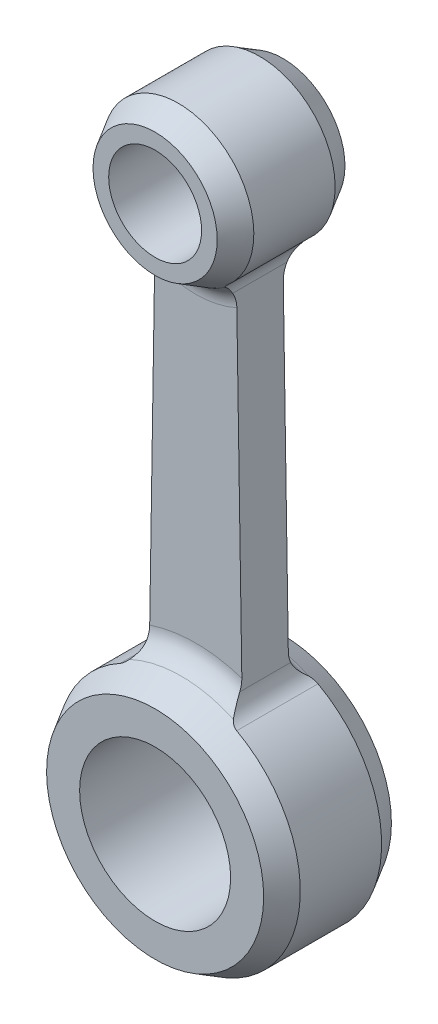
from build123d import *

# Parameters (mm, degrees)
ESQUISSE1_R          = 6.5
ESQUISSE1_R_2        = 4
BASE_EXTRUSION_DEPTH = 4
ESQUISSE2_R          = 6.5
ESQUISSE2_R_2        = 4
ESQUISSE2_R_3        = 10.5
BOSS_EXTRU_1_DEPTH   = 3.5
BOSS_EXTRU_2_START   = 3.5
ESQUISSE3_R          = 6.5
ESQUISSE3_R_2        = 4
ESQUISSE3_R_3        = 10.5
BOSS_EXTRU_2_DEPTH   = 3.5
CONG_1_R             = 2


with BuildPart() as part:
    # Esquisse1 → Base-Extrusion (new body)
    with BuildSketch(Plane.XY):
        with BuildLine():
            Line((-3.5, 41.522774425), (-4, 9.708243919))
            ThreePointArc((-4, 9.708243919), (0, -10.5), (4, 9.708243919))
            Line((4, 9.708243919), (3.5, 41.522774425))
            ThreePointArc((3.5, 41.522774425), (0, 53.5), (-3.5, 41.522774425))
        make_face()
        Circle(ESQUISSE1_R, mode=Mode.SUBTRACT)
        with Locations((0, 47)):
            Circle(ESQUISSE1_R_2, mode=Mode.SUBTRACT)
    extrude(amount=BASE_EXTRUSION_DEPTH)

    # Esquisse2 → Boss.-Extru.1 (add)
    # profile 1 of 2: a face of its own
    with BuildSketch(Plane.XY.offset(4)):
        with Locations(Location((0, 47, 0), (0, 0, 237.421029607))):
            Circle(ESQUISSE2_R)
        with Locations((0, 47)):
            Circle(ESQUISSE2_R_2, mode=Mode.SUBTRACT)
    # profile 2 of 2: a face of its own
    with BuildSketch(Plane.XY.offset(4)):
        with Locations(Location((0, 0, 0), (0, 0, 112.392687805))):
            Circle(ESQUISSE2_R_3)
        Circle(ESQUISSE2_R, mode=Mode.SUBTRACT)
    extrude(amount=BOSS_EXTRU_1_DEPTH)

    # Esquisse3 → Boss.-Extru.2 (add)
    # profile 1 of 2: a face of its own
    with BuildSketch(Plane(origin=(0, 0, 0), x_dir=(-1, 0, 0), z_dir=(0, 0, -1)).offset(BOSS_EXTRU_2_START)):
        with Locations((0, 47)):
            Circle(ESQUISSE3_R)
        with Locations((0, 47)):
            Circle(ESQUISSE3_R_2, mode=Mode.SUBTRACT)
    # profile 2 of 2: a face of its own
    with BuildSketch(Plane(origin=(0, 0, 0), x_dir=(-1, 0, 0), z_dir=(0, 0, -1)).offset(BOSS_EXTRU_2_START)):
        Circle(ESQUISSE3_R_3)
        Circle(ESQUISSE3_R, mode=Mode.SUBTRACT)
    extrude(amount=-BOSS_EXTRU_2_DEPTH)

    # Congé1
    # the kernel refuses this fillet: 2 mm, written as the material it adds along each edge
    with BuildSketch(Plane(origin=(0, 47, 4), x_dir=(-0.9730257841086011, -0.23069638805113993, 0), z_dir=(-0.23069638805113993, 0.9730257841086011, 0))) as cong_1_piece_1_section:
        with BuildLine():
            CenterArc((6.5 + CONG_1_R, CONG_1_R), CONG_1_R, 180, 90)
            Line((6.5 + CONG_1_R, 0), (6.5, 0))
            Line((6.5, 0), (6.5, CONG_1_R))
        make_face()
    cong_1_piece_1 = revolve(axis=Axis((0, 47, 4), (0, 0, 1)), revolution_arc=153.323851042, mode=Mode.PRIVATE)
    cong_1_piece_1 = split(cong_1_piece_1, bisect_by=Plane(origin=(3.517247673, 40.425321182, 4.453760359), z_dir=(-0.9998765251425995, -0.015714148680750627, 0)), keep=Keep.TOP, mode=Mode.PRIVATE)
    cong_1_piece_1 = split(cong_1_piece_1, bisect_by=Plane(origin=(-3.517247673, 40.425321169, 4.453760359), z_dir=(0.9998765251425995, -0.0157141486807504, 0)), keep=Keep.TOP, mode=Mode.PRIVATE)
    add(cong_1_piece_1)
    with BuildSketch(Plane(origin=(0, 0, 4), x_dir=(0.7624324114570696, 0.6470678619432104, 0), z_dir=(0.6470678619432104, -0.7624324114570696, 0))) as cong_1_piece_2_section:
        with BuildLine():
            CenterArc((10.5 + CONG_1_R, CONG_1_R), CONG_1_R, 180, 90)
            Line((10.5, CONG_1_R), (10.5, 0))
            Line((10.5, 0), (10.5 + CONG_1_R, 0))
        make_face()
    cong_1_piece_2 = revolve(axis=Axis((0, 0, 4), (0, 0, 1)), revolution_arc=99.358211417, mode=Mode.PRIVATE)
    cong_1_piece_2 = split(cong_1_piece_2, bisect_by=Plane(origin=(3.983456329, 10.760902188, 4.453755319), z_dir=(-0.9998765251425995, -0.015714148680750627, 0)), keep=Keep.TOP, mode=Mode.PRIVATE)
    cong_1_piece_2 = split(cong_1_piece_2, bisect_by=Plane(origin=(-3.983456328, 10.760902231, 4.453755319), z_dir=(0.9998765251425995, -0.0157141486807504, 0)), keep=Keep.TOP, mode=Mode.PRIVATE)
    add(cong_1_piece_2)
    with BuildSketch(Plane(origin=(0, 47, 0), x_dir=(0.9730257841078124, -0.23069638805446635, 0), z_dir=(0.23069638805446635, 0.9730257841078124, 0))) as cong_1_piece_3_section:
        with BuildLine():
            CenterArc((6.5 + CONG_1_R, CONG_1_R), CONG_1_R, 180, 90)
            Line((6.5, CONG_1_R), (6.5, 0))
            Line((6.5, 0), (6.5 + CONG_1_R, 0))
        make_face()
    cong_1_piece_3 = revolve(axis=Axis((0, 47, 0), (0, 0, -1)), revolution_arc=153.323851042, mode=Mode.PRIVATE)
    cong_1_piece_3 = split(cong_1_piece_3, bisect_by=Plane(origin=(3.517247674, 40.425321152, -0.453760356), z_dir=(-0.9998765251425995, -0.015714148680750627, 0)), keep=Keep.TOP, mode=Mode.PRIVATE)
    cong_1_piece_3 = split(cong_1_piece_3, bisect_by=Plane(origin=(-3.517247674, 40.425321145, -0.453760356), z_dir=(0.9998765251425995, -0.0157141486807504, 0)), keep=Keep.TOP, mode=Mode.PRIVATE)
    add(cong_1_piece_3)
    with BuildSketch(Plane(origin=(0, 0, 0), x_dir=(-0.7624324114570697, 0.6470678619432102, 0), z_dir=(-0.6470678619432102, -0.7624324114570697, 0))) as cong_1_piece_4_section:
        with BuildLine():
            CenterArc((10.5 + CONG_1_R, CONG_1_R), CONG_1_R, 180, 90)
            Line((10.5, CONG_1_R), (10.5, 0))
            Line((10.5, 0), (10.5 + CONG_1_R, 0))
        make_face()
    cong_1_piece_4 = revolve(axis=Axis((0, 0, 0), (0, 0, -1)), revolution_arc=99.358211417, mode=Mode.PRIVATE)
    cong_1_piece_4 = split(cong_1_piece_4, bisect_by=Plane(origin=(3.983456329, 10.760902188, -0.453755319), z_dir=(-0.9998765251425995, -0.015714148680750627, 0)), keep=Keep.TOP, mode=Mode.PRIVATE)
    cong_1_piece_4 = split(cong_1_piece_4, bisect_by=Plane(origin=(-3.983456328, 10.760902231, -0.453755319), z_dir=(0.9998765251425995, -0.0157141486807504, 0)), keep=Keep.TOP, mode=Mode.PRIVATE)
    add(cong_1_piece_4)
    with BuildSketch(Plane(origin=(3.5, 41.522774425, 0), x_dir=(0.015714148680751626, -0.9998765251425993, 0), z_dir=(0, 0, 1))) as cong_1_piece_5:
        with BuildLine():
            CenterArc((1.021621466, 2), CONG_1_R, 219.559716944, 50.440283056)
            ThreePointArc((-0.520300949, 0.726235788), (-0.247658669, 0.372067464), (0, 0))
            Line((0, 0), (1.021621466, 0))
        make_face()
    extrude(amount=4)
    with BuildSketch(Plane(origin=(4, 9.708243919, 0), x_dir=(-0.01571414868075148, 0.9998765251425994, 0), z_dir=(0, 0, 1))) as cong_1_piece_6:
        with BuildLine():
            CenterArc((1.237085323, -2), CONG_1_R, 90, 60.517017612)
            ThreePointArc((-0.503918505, -1.015669938), (-0.238240031, -0.514641677), (0, 0))
            Line((0, 0), (1.237085323, 0))
        make_face()
    extrude(amount=4)
    with BuildSketch(Plane(origin=(-4, 9.708243919, 0), x_dir=(-0.902678139107061, -0.4303163687082024, 0), z_dir=(0, 0, 1))) as cong_1_piece_7:
        with BuildLine():
            CenterArc((1.241789087, -1.997082863), CONG_1_R, 93.094951563, 60.517017612)
            Line((-0.549820165, -1.108186755), (0, 0))
            ThreePointArc((0, 0), (0.566903714, -0.01531497), (1.133807427, 0))
        make_face()
    extrude(amount=4)
    with BuildSketch(Plane(origin=(-3.5, 41.522774425, 0), x_dir=(-0.8036539633603179, 0.5950968888973062, 0), z_dir=(0, 0, 1))) as cong_1_piece_8:
        with BuildLine():
            CenterArc((1.030825449, 1.995271739), CONG_1_R, 215.61914794, 50.440283056)
            Line((-0.594986898, 0.830482396), (0, 0))
            ThreePointArc((0, 0), (0.446691028, 0.015366847), (0.893382055, 0))
        make_face()
    extrude(amount=4)
    with BuildSketch(Plane(origin=(-3.5, 41.522774425, 0), x_dir=(-0.8036539633603179, 0.5950968888973062, 0), z_dir=(0, 0, 1))) as cong_1_piece_9a_section:
        with BuildLine():
            CenterArc((1.030825449, 1.995271739), CONG_1_R, 215.61914794, 50.440283056)
            Line((-0.594986898, 0.830482396), (0, 0))
            ThreePointArc((0, 0), (0.446691028, 0.015366847), (0.893382055, 0))
        make_face()
    cong_1_piece_9a = extrude(amount=6.554053664, mode=Mode.PRIVATE)
    cong_1_piece_9a = split(cong_1_piece_9a, bisect_by=Plane(origin=(-3.656694751, 41.398372056, 4), z_dir=(0, 0, 1)), keep=Keep.TOP, mode=Mode.PRIVATE)
    with BuildSketch(Plane(origin=(0, 47, 4), x_dir=(-0.9730257841086011, -0.23069638805113993, 0), z_dir=(-0.23069638805113993, 0.9730257841086011, 0))) as cong_1_piece_9b_section:
        with BuildLine():
            CenterArc((6.5 + CONG_1_R, CONG_1_R), CONG_1_R, 180, 90)
            Line((6.5 + CONG_1_R, 0), (6.5, 0))
            Line((6.5, 0), (6.5, CONG_1_R))
        make_face()
    cong_1_piece_9b = revolve(axis=Axis((0, 47, 4), (0, 0, 1)), revolution_arc=153.323851042, mode=Mode.PRIVATE)
    cong_1_piece_9b = split(cong_1_piece_9b, bisect_by=Plane(origin=(-3.4781959, 42.910148851, 4.426023239), z_dir=(-0.9998765251425995, 0.0157141486807504, 0)), keep=Keep.TOP, mode=Mode.PRIVATE)
    cong_1_piece_9 = cong_1_piece_9a & cong_1_piece_9b
    add(cong_1_piece_9)
    with BuildSketch(Plane(origin=(3.5, 41.522774425, 0), x_dir=(0.015714148680751626, -0.9998765251425993, 0), z_dir=(0, 0, 1))) as cong_1_piece_10a_section:
        with BuildLine():
            CenterArc((1.021621466, 2), CONG_1_R, 219.559716944, 50.440283056)
            ThreePointArc((-0.520300949, 0.726235788), (-0.247658669, 0.372067464), (0, 0))
            Line((0, 0), (1.021621466, 0))
        make_face()
    cong_1_piece_10a = extrude(amount=6.554053664, mode=Mode.PRIVATE)
    cong_1_piece_10a = split(cong_1_piece_10a, bisect_by=Plane(origin=(3.656694751, 41.398372056, 4), z_dir=(0, 0, 1)), keep=Keep.TOP, mode=Mode.PRIVATE)
    with BuildSketch(Plane(origin=(0, 47, 4), x_dir=(-0.9730257841086011, -0.23069638805113993, 0), z_dir=(-0.23069638805113993, 0.9730257841086011, 0))) as cong_1_piece_10b_section:
        with BuildLine():
            CenterArc((6.5 + CONG_1_R, CONG_1_R), CONG_1_R, 180, 90)
            Line((6.5 + CONG_1_R, 0), (6.5, 0))
            Line((6.5, 0), (6.5, CONG_1_R))
        make_face()
    cong_1_piece_10b = revolve(axis=Axis((0, 47, 4), (0, 0, 1)), revolution_arc=153.323851042, mode=Mode.PRIVATE)
    cong_1_piece_10b = split(cong_1_piece_10b, bisect_by=Plane(origin=(3.478195889, 42.91014955, 4.426023438), z_dir=(0.9998765251425995, 0.015714148680750627, 0)), keep=Keep.TOP, mode=Mode.PRIVATE)
    cong_1_piece_10 = cong_1_piece_10a & cong_1_piece_10b
    add(cong_1_piece_10)
    with BuildSketch(Plane(origin=(4, 9.708243919, 0), x_dir=(-0.01571414868075148, 0.9998765251425994, 0), z_dir=(0, 0, 1))) as cong_1_piece_11a_section:
        with BuildLine():
            CenterArc((1.237085323, -2), CONG_1_R, 90, 60.517017612)
            ThreePointArc((-0.503918505, -1.015669938), (-0.238240031, -0.514641677), (0, 0))
            Line((0, 0), (1.237085323, 0))
        make_face()
    cong_1_piece_11a = extrude(amount=7.092713308, mode=Mode.PRIVATE)
    cong_1_piece_11a = split(cong_1_piece_11a, bisect_by=Plane(origin=(4.217733498, 9.886431085, 4), z_dir=(0, 0, 1)), keep=Keep.TOP, mode=Mode.PRIVATE)
    with BuildSketch(Plane(origin=(0, 0, 4), x_dir=(0.7624324114570696, 0.6470678619432104, 0), z_dir=(0.6470678619432104, -0.7624324114570696, 0))) as cong_1_piece_11b_section:
        with BuildLine():
            CenterArc((10.5 + CONG_1_R, CONG_1_R), CONG_1_R, 180, 90)
            Line((10.5, CONG_1_R), (10.5, 0))
            Line((10.5, 0), (10.5 + CONG_1_R, 0))
        make_face()
    cong_1_piece_11b = revolve(axis=Axis((0, 0, 4), (0, 0, 1)), revolution_arc=99.358211417, mode=Mode.PRIVATE)
    cong_1_piece_11b = split(cong_1_piece_11b, bisect_by=Plane(origin=(4.014039925, 8.814896672, 4.434458184), z_dir=(0.9998765251425995, 0.015714148680750627, 0)), keep=Keep.TOP, mode=Mode.PRIVATE)
    cong_1_piece_11 = cong_1_piece_11a & cong_1_piece_11b
    add(cong_1_piece_11)
    with BuildSketch(Plane(origin=(-4, 9.708243919, 0), x_dir=(-0.902678139107061, -0.4303163687082024, 0), z_dir=(0, 0, 1))) as cong_1_piece_12a_section:
        with BuildLine():
            CenterArc((1.241789087, -1.997082863), CONG_1_R, 93.094951563, 60.517017612)
            Line((-0.549820165, -1.108186755), (0, 0))
            ThreePointArc((0, 0), (0.566903714, -0.01531497), (1.133807427, 0))
        make_face()
    cong_1_piece_12a = extrude(amount=7.092713308, mode=Mode.PRIVATE)
    cong_1_piece_12a = split(cong_1_piece_12a, bisect_by=Plane(origin=(-4.217733498, 9.886431085, 4), z_dir=(0, 0, 1)), keep=Keep.TOP, mode=Mode.PRIVATE)
    with BuildSketch(Plane(origin=(0, 0, 4), x_dir=(0.7624324114570696, 0.6470678619432104, 0), z_dir=(0.6470678619432104, -0.7624324114570696, 0))) as cong_1_piece_12b_section:
        with BuildLine():
            CenterArc((10.5 + CONG_1_R, CONG_1_R), CONG_1_R, 180, 90)
            Line((10.5, CONG_1_R), (10.5, 0))
            Line((10.5, 0), (10.5 + CONG_1_R, 0))
        make_face()
    cong_1_piece_12b = revolve(axis=Axis((0, 0, 4), (0, 0, 1)), revolution_arc=99.358211417, mode=Mode.PRIVATE)
    cong_1_piece_12b = split(cong_1_piece_12b, bisect_by=Plane(origin=(-4.014039941, 8.814895643, 4.434458219), z_dir=(-0.9998765251425995, 0.0157141486807504, 0)), keep=Keep.TOP, mode=Mode.PRIVATE)
    cong_1_piece_12 = cong_1_piece_12a & cong_1_piece_12b
    add(cong_1_piece_12)
    with BuildSketch(Plane(origin=(3.5, 41.522774425, -2.554053664), x_dir=(0.01571414868075119, -0.9998765251425993, 0), z_dir=(0, 0, 1))) as cong_1_piece_13a_section:
        with BuildLine():
            CenterArc((1.021621466, 2), CONG_1_R, 219.559716944, 50.440283056)
            ThreePointArc((-0.520300949, 0.726235788), (-0.247658669, 0.372067464), (0, 0))
            Line((0, 0), (1.021621466, 0))
        make_face()
    cong_1_piece_13a = extrude(amount=6.554053664, mode=Mode.PRIVATE)
    cong_1_piece_13a = split(cong_1_piece_13a, bisect_by=Plane(origin=(3.656694751, 41.398372056, 0), z_dir=(0, 0, -1)), keep=Keep.TOP, mode=Mode.PRIVATE)
    with BuildSketch(Plane(origin=(0, 47, 0), x_dir=(0.9730257841078124, -0.23069638805446635, 0), z_dir=(0.23069638805446635, 0.9730257841078124, 0))) as cong_1_piece_13b_section:
        with BuildLine():
            CenterArc((6.5 + CONG_1_R, CONG_1_R), CONG_1_R, 180, 90)
            Line((6.5, CONG_1_R), (6.5, 0))
            Line((6.5, 0), (6.5 + CONG_1_R, 0))
        make_face()
    cong_1_piece_13b = revolve(axis=Axis((0, 47, 0), (0, 0, -1)), revolution_arc=153.323851042, mode=Mode.PRIVATE)
    cong_1_piece_13b = split(cong_1_piece_13b, bisect_by=Plane(origin=(3.478195898, 42.910148966, -0.426023306), z_dir=(0.9998765251425995, 0.015714148680750627, 0)), keep=Keep.TOP, mode=Mode.PRIVATE)
    cong_1_piece_13 = cong_1_piece_13a & cong_1_piece_13b
    add(cong_1_piece_13)
    with BuildSketch(Plane(origin=(-3.5, 41.522774425, -2.554053664), x_dir=(-0.8036539633603179, 0.5950968888973062, 0), z_dir=(0, 0, 1))) as cong_1_piece_14a_section:
        with BuildLine():
            CenterArc((1.030825449, 1.995271739), CONG_1_R, 215.61914794, 50.440283056)
            Line((-0.594986898, 0.830482396), (0, 0))
            ThreePointArc((0, 0), (0.446691028, 0.015366847), (0.893382055, 0))
        make_face()
    cong_1_piece_14a = extrude(amount=6.554053664, mode=Mode.PRIVATE)
    cong_1_piece_14a = split(cong_1_piece_14a, bisect_by=Plane(origin=(-3.656694751, 41.398372056, 0), z_dir=(0, 0, -1)), keep=Keep.TOP, mode=Mode.PRIVATE)
    with BuildSketch(Plane(origin=(0, 47, 0), x_dir=(0.9730257841078124, -0.23069638805446635, 0), z_dir=(0.23069638805446635, 0.9730257841078124, 0))) as cong_1_piece_14b_section:
        with BuildLine():
            CenterArc((6.5 + CONG_1_R, CONG_1_R), CONG_1_R, 180, 90)
            Line((6.5, CONG_1_R), (6.5, 0))
            Line((6.5, 0), (6.5 + CONG_1_R, 0))
        make_face()
    cong_1_piece_14b = revolve(axis=Axis((0, 47, 0), (0, 0, -1)), revolution_arc=153.323851042, mode=Mode.PRIVATE)
    cong_1_piece_14b = split(cong_1_piece_14b, bisect_by=Plane(origin=(-3.478195892, 42.910149335, -0.42602338), z_dir=(-0.9998765251425995, 0.0157141486807504, 0)), keep=Keep.TOP, mode=Mode.PRIVATE)
    cong_1_piece_14 = cong_1_piece_14a & cong_1_piece_14b
    add(cong_1_piece_14)
    with BuildSketch(Plane(origin=(-4, 9.708243919, -3.092713308), x_dir=(-0.9026781391070603, -0.43031636870820344, 0), z_dir=(0, 0, 1))) as cong_1_piece_15a_section:
        with BuildLine():
            CenterArc((1.241789087, -1.997082863), CONG_1_R, 93.094951563, 60.517017612)
            Line((-0.549820165, -1.108186755), (0, 0))
            ThreePointArc((0, 0), (0.566903714, -0.01531497), (1.133807427, 0))
        make_face()
    cong_1_piece_15a = extrude(amount=7.092713308, mode=Mode.PRIVATE)
    cong_1_piece_15a = split(cong_1_piece_15a, bisect_by=Plane(origin=(-4.217733498, 9.886431085, 0), z_dir=(0, 0, -1)), keep=Keep.TOP, mode=Mode.PRIVATE)
    with BuildSketch(Plane(origin=(0, 0, 0), x_dir=(-0.7624324114570697, 0.6470678619432102, 0), z_dir=(-0.6470678619432102, -0.7624324114570697, 0))) as cong_1_piece_15b_section:
        with BuildLine():
            CenterArc((10.5 + CONG_1_R, CONG_1_R), CONG_1_R, 180, 90)
            Line((10.5, CONG_1_R), (10.5, 0))
            Line((10.5, 0), (10.5 + CONG_1_R, 0))
        make_face()
    cong_1_piece_15b = revolve(axis=Axis((0, 0, 0), (0, 0, -1)), revolution_arc=99.358211417, mode=Mode.PRIVATE)
    cong_1_piece_15b = split(cong_1_piece_15b, bisect_by=Plane(origin=(-4.014039934, 8.814896084, -0.434458135), z_dir=(-0.9998765251425995, 0.0157141486807504, 0)), keep=Keep.TOP, mode=Mode.PRIVATE)
    cong_1_piece_15 = cong_1_piece_15a & cong_1_piece_15b
    add(cong_1_piece_15)
    with BuildSketch(Plane(origin=(4, 9.708243919, -3.092713308), x_dir=(-0.015714148680750762, 0.9998765251425994, 0), z_dir=(0, 0, 1))) as cong_1_piece_16a_section:
        with BuildLine():
            CenterArc((1.237085323, -2), CONG_1_R, 90, 60.517017612)
            ThreePointArc((-0.503918505, -1.015669938), (-0.238240031, -0.514641677), (0, 0))
            Line((0, 0), (1.237085323, 0))
        make_face()
    cong_1_piece_16a = extrude(amount=7.092713308, mode=Mode.PRIVATE)
    cong_1_piece_16a = split(cong_1_piece_16a, bisect_by=Plane(origin=(4.217733498, 9.886431085, 0), z_dir=(0, 0, -1)), keep=Keep.TOP, mode=Mode.PRIVATE)
    with BuildSketch(Plane(origin=(0, 0, 0), x_dir=(-0.7624324114570697, 0.6470678619432102, 0), z_dir=(-0.6470678619432102, -0.7624324114570697, 0))) as cong_1_piece_16b_section:
        with BuildLine():
            CenterArc((10.5 + CONG_1_R, CONG_1_R), CONG_1_R, 180, 90)
            Line((10.5, CONG_1_R), (10.5, 0))
            Line((10.5, 0), (10.5 + CONG_1_R, 0))
        make_face()
    cong_1_piece_16b = revolve(axis=Axis((0, 0, 0), (0, 0, -1)), revolution_arc=99.358211417, mode=Mode.PRIVATE)
    cong_1_piece_16b = split(cong_1_piece_16b, bisect_by=Plane(origin=(4.014039932, 8.814896231, -0.434458268), z_dir=(0.9998765251425995, 0.015714148680750627, 0)), keep=Keep.TOP, mode=Mode.PRIVATE)
    cong_1_piece_16 = cong_1_piece_16a & cong_1_piece_16b
    add(cong_1_piece_16)

    # Chanfrein1
    # the kernel refuses this chamfer: 2, 1.154700538 mm, written as the material it takes off along each edge
    with BuildSketch(Plane(origin=(0, 47, 7.5), x_dir=(-0.5384615384644191, -0.8426500884676456, 0), z_dir=(-0.8426500884676456, 0.5384615384644191, 0))) as chanfrein1_piece_1:
        with BuildLine():
            Line((6.8, -2.519615242), (5.045299462, 0.519615242))
            Line((5.045299462, 0.519615242), (5.045299462, 0.819615242))
            ThreePointArc((5.045299462, 0.819615242), (5.772649731, 0.3), (6.5, 0.3))
            Line((6.5, 0.3), (6.8, 0))
            ThreePointArc((6.8, 0), (6.8, -1.259807621), (7.1, -2.519615242))
            Line((7.1, -2.519615242), (6.8, -2.519615242))
        make_face()
    revolve(axis=Axis((0, 47, 7.5), (0, 0, 1)), mode=Mode.SUBTRACT)
    with BuildSketch(Plane(origin=(0, 0, 7.5), x_dir=(-0.3809523809458997, 0.924594659000175, 0), z_dir=(0.924594659000175, 0.3809523809458997, 0))) as chanfrein1_piece_2:
        with BuildLine():
            Line((9.045299462, 0.519615242), (10.8, -2.519615242))
            Line((10.8, -2.519615242), (11.1, -2.519615242))
            ThreePointArc((11.1, -2.519615242), (10.8, -1.259807621), (10.8, 0))
            Line((10.8, 0), (10.5, 0.3))
            ThreePointArc((10.5, 0.3), (9.772649731, 0.3), (9.045299462, 0.819615242))
            Line((9.045299462, 0.819615242), (9.045299462, 0.519615242))
        make_face()
    revolve(axis=Axis((0, 0, 7.5), (0, 0, 1)), mode=Mode.SUBTRACT)
    with BuildSketch(Plane(origin=(0, 47, -3.5), x_dir=(-1, 0, 0), z_dir=(0, -1, 0))) as chanfrein1_piece_3:
        with BuildLine():
            Line((5.045299462, 0.519615242), (6.8, -2.519615242))
            Line((6.8, -2.519615242), (7.1, -2.519615242))
            ThreePointArc((7.1, -2.519615242), (6.8, -1.259807621), (6.8, 0))
            Line((6.8, 0), (6.5, 0.3))
            ThreePointArc((6.5, 0.3), (5.772649731, 0.3), (5.045299462, 0.819615242))
            Line((5.045299462, 0.819615242), (5.045299462, 0.519615242))
        make_face()
    revolve(axis=Axis((0, 47, -3.5), (0, 0, -1)), mode=Mode.SUBTRACT)
    with BuildSketch(Plane(origin=(0, 0, -3.5), x_dir=(-1, 0, 0), z_dir=(0, -1, 0))) as chanfrein1_piece_4:
        with BuildLine():
            Line((10.8, -2.519615242), (9.045299462, 0.519615242))
            Line((9.045299462, 0.519615242), (9.045299462, 0.819615242))
            ThreePointArc((9.045299462, 0.819615242), (9.772649731, 0.3), (10.5, 0.3))
            Line((10.5, 0.3), (10.8, 0))
            ThreePointArc((10.8, 0), (10.8, -1.259807621), (11.1, -2.519615242))
            Line((11.1, -2.519615242), (10.8, -2.519615242))
        make_face()
    revolve(axis=Axis((0, 0, -3.5), (0, 0, -1)), mode=Mode.SUBTRACT)


solid = part.part
